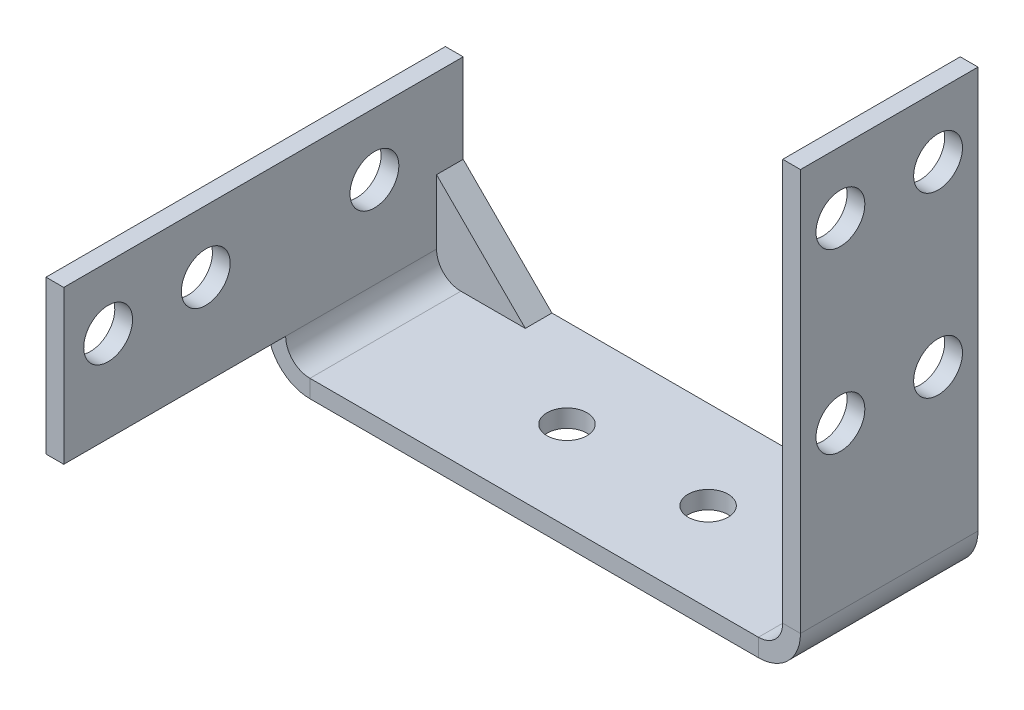
from build123d import *

# Parameters (mm, degrees)
SKETCH_1_W                         = 60
SKETCH_1_H                         = 20
SM_BASE_FLANGE_1_DEPTH             = 2
SM_EDGE_FLANGE_1_STRIP_W           = 13.4732
SM_EDGE_FLANGE_1_STRIP_H           = 2
SM_EDGE_FLANGE_1_STRIP_CUT_DEPTH   = 20
SM_EDGE_FLANGE_1_STRIP_2_W         = 13.4732
SM_EDGE_FLANGE_1_STRIP_2_H         = 2
SM_EDGE_FLANGE_1_STRIP_CUT_2_DEPTH = 20
SM_EDGE_FLANGE_1_DEPTH             = 20
SM_EDGE_FLANGE_1_BEND_DEPTH        = 20
SM_EDGE_FLANGE_1_PROFILE_W         = 45
SM_EDGE_FLANGE_1_PROFILE_H         = 17.2634
SM_EDGE_FLANGE_1_FLAT_DEPTH        = 2
RIB_2_REACH                        = 74.312
SKETCH_12_WALL_W                   = 160.765785142
SKETCH_12_WALL_H                   = 3
CUT_EXTRUDE_1_REACH                = 86.433
SKETCH_13_R                        = 2.75
CUT_EXTRUDE_1_DIRECTION_2_DEPTH    = 85.433405711
SKETCH_15_R                        = 2.75
CUT_EXTRUDE_2_DEPTH                = 10
SKETCH_16_R                        = 2.25
CUT_EXTRUDE_3_DEPTH                = 10


# Sheet-metal steps are written as plain solids
with BuildPart() as part:
    # Sketch 1 → 基体-法兰1 (new body)
    with BuildSketch(Plane(origin=(0, 0, 0), x_dir=(1, 0, 0), z_dir=(0, 1, 0))):
        Rectangle(SKETCH_1_W, SKETCH_1_H)
    extrude(amount=-SM_BASE_FLANGE_1_DEPTH)

    # 边线-法兰1 strip (across the edge) → 边线-法兰1 strip cut (cut)
    with BuildSketch(Plane(origin=(30, 0, 10), x_dir=(-1, 0, 0), z_dir=(0, 0, -1))):
        with Locations((-2, -1)):
            Rectangle(SM_EDGE_FLANGE_1_STRIP_W, SM_EDGE_FLANGE_1_STRIP_H)
    extrude(amount=SM_EDGE_FLANGE_1_STRIP_CUT_DEPTH, mode=Mode.SUBTRACT)

    # 边线-法兰1 strip 2 (across the edge) → 边线-法兰1 strip cut 2 (cut)
    with BuildSketch(Plane(origin=(-30, 0, -10), x_dir=(1, 0, 0), z_dir=(0, 0, 1))):
        with Locations((-2, -1)):
            Rectangle(SM_EDGE_FLANGE_1_STRIP_2_W, SM_EDGE_FLANGE_1_STRIP_2_H)
    extrude(amount=SM_EDGE_FLANGE_1_STRIP_CUT_2_DEPTH, mode=Mode.SUBTRACT)

    # 边线-法兰1 section (across the edge) → 边线-法兰1 (add)
    with BuildSketch(Plane(origin=(30, 0, 10), x_dir=(-1, 0, 0), z_dir=(0, 0, -1))):
        with BuildLine():
            Line((0, 2.7366), (0, 48))
            Line((0, 48), (2, 48))
            Line((2, 48), (2, 2.7366))
            ThreePointArc((2, 2.7366), (2.801531583, 0.801531583), (4.7366, 0))
            Line((4.7366, 0), (4.7366, -2))
            ThreePointArc((4.7366, -2), (1.38731802, -0.61268198), (0, 2.7366))
        make_face()
    extrude(amount=SM_EDGE_FLANGE_1_DEPTH)

    # 边线-法兰1 bend section (across the edge) → 边线-法兰1 bend (add)
    with BuildSketch(Plane(origin=(-30, 0, -10), x_dir=(1, 0, 0), z_dir=(0, 0, 1))):
        with BuildLine():
            Line((0, 2.7366), (2, 2.7366))
            ThreePointArc((2, 2.7366), (2.801531583, 0.801531583), (4.7366, 0))
            Line((4.7366, 0), (4.7366, -2))
            ThreePointArc((4.7366, -2), (1.38731802, -0.61268198), (0, 2.7366))
        make_face()
    extrude(amount=SM_EDGE_FLANGE_1_BEND_DEPTH)

    # 边线-法兰1 profile (on flange) → 边线-法兰1 flat (add)
    with BuildSketch(Plane(origin=(-30, 0, 0), x_dir=(0, 0, -1), z_dir=(1, 0, 0))):
        with Locations((-12.5, 11.3683)):
            Rectangle(SM_EDGE_FLANGE_1_PROFILE_W, SM_EDGE_FLANGE_1_PROFILE_H)
    extrude(amount=SM_EDGE_FLANGE_1_FLAT_DEPTH)

    # 草图12 wall → 筋2 (add, up to next)
    with BuildSketch(Plane(origin=(-23, 5, -10), x_dir=(0.707106781187, -0.707106781187, 0), z_dir=(-0.707106781187, -0.707106781187, 0)), mode=Mode.PRIVATE) as rib_2_sk1:
        with Locations((0, 1.5)):
            Rectangle(SKETCH_12_WALL_W, SKETCH_12_WALL_H)
    rib_2_tool1 = extrude(rib_2_sk1.sketch, amount=RIB_2_REACH, mode=Mode.PRIVATE) - part.part
    rib_2 = rib_2_tool1.solids().sort_by_distance((-23, 5, -10))[0]
    add(rib_2)

    # 镜向1: 筋2 across plane
    add(rib_2.mirror(Plane(origin=(0, 0, 0), x_dir=(0, 0, 1), z_dir=(1, 0, 0))))

    # 草图13 → 切除-拉伸1 (cut, up to next)
    with BuildSketch(Plane.ZY.offset(30), mode=Mode.PRIVATE) as cut_extrude_1_sk1:
        with Locations(Location((0, 13, 0), (0, 0, 90))):
            Circle(SKETCH_13_R)
    cut_extrude_1_tool1 = extrude(cut_extrude_1_sk1.sketch, amount=-CUT_EXTRUDE_1_REACH, mode=Mode.PRIVATE) & part.part
    # 草图13 → 切除-拉伸1 (cut, up to next)
    with BuildSketch(Plane.ZY.offset(30), mode=Mode.PRIVATE) as cut_extrude_1_sk2:
        with Locations(Location((19, 13, 0), (0, 0, 90))):
            Circle(SKETCH_13_R)
    cut_extrude_1_tool2 = extrude(cut_extrude_1_sk2.sketch, amount=-CUT_EXTRUDE_1_REACH, mode=Mode.PRIVATE) & part.part
    # 草图13 → 切除-拉伸1 (cut, up to next)
    with BuildSketch(Plane.ZY.offset(30), mode=Mode.PRIVATE) as cut_extrude_1_sk3:
        with Locations(Location((30, 13, 0), (0, 0, 90))):
            Circle(SKETCH_13_R)
    cut_extrude_1_tool3 = extrude(cut_extrude_1_sk3.sketch, amount=-CUT_EXTRUDE_1_REACH, mode=Mode.PRIVATE) & part.part
    add(cut_extrude_1_tool1.solids().sort_by_distance((-30, 13, 0))[0], mode=Mode.SUBTRACT)
    add(cut_extrude_1_tool2.solids().sort_by_distance((-30, 13, 19))[0], mode=Mode.SUBTRACT)
    add(cut_extrude_1_tool3.solids().sort_by_distance((-30, 13, 30))[0], mode=Mode.SUBTRACT)

    # 草图13 → 切除-拉伸1 direction 2 (cut)
    with BuildSketch(Plane.ZY.offset(30)):
        with Locations(Location((0, 13, 0), (0, 0, 90))):
            Circle(SKETCH_13_R)
        with Locations(Location((19, 13, 0), (0, 0, 90))):
            Circle(SKETCH_13_R)
        with Locations(Location((30, 13, 0), (0, 0, 90))):
            Circle(SKETCH_13_R)
    extrude(amount=CUT_EXTRUDE_1_DIRECTION_2_DEPTH, mode=Mode.SUBTRACT)

    # 草图15 → 切除-拉伸2 (cut)
    with BuildSketch(Plane.ZY.offset(-28)):
        with Locations(Location((-5.5, 21, 0), (0, 0, 270))):
            Circle(SKETCH_15_R)
        with Locations(Location((5.5, 21, 0), (0, 0, 270))):
            Circle(SKETCH_15_R)
        with Locations(Location((5.5, 41, 0), (0, 0, 270))):
            Circle(SKETCH_15_R)
        with Locations(Location((-5.5, 41, 0), (0, 0, 270))):
            Circle(SKETCH_15_R)
    extrude(amount=-CUT_EXTRUDE_2_DEPTH, mode=Mode.SUBTRACT)

    # 草图16 → 切除-拉伸3 (cut)
    with BuildSketch(Plane.XZ.offset(2)):
        with Locations(Location((9.593773501, 0, 0), (0, 0, 270))):
            Circle(SKETCH_16_R)
        with Locations(Location((-6.30510484, 0, 0), (0, 0, 270))):
            Circle(SKETCH_16_R)
    extrude(amount=-CUT_EXTRUDE_3_DEPTH, mode=Mode.SUBTRACT)


solid = part.part
